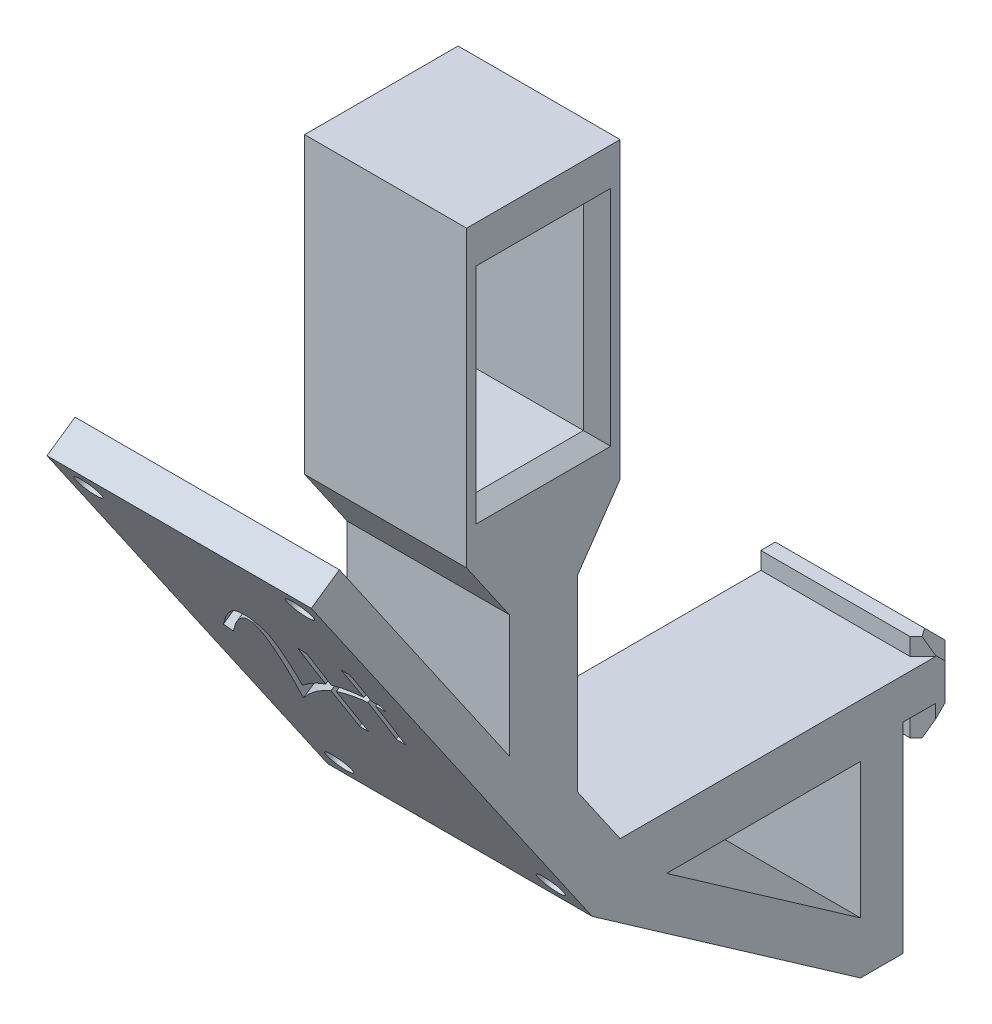
from build123d import *

# Parameters (mm, degrees)
BOSS_EXTRUDE1_DEPTH     = 19
SKETCH3_W               = 5.025645198
SKETCH3_H               = 33.799871634
BOSS_EXTRUDE2_DEPTH     = 19
SKETCH4_W               = 5.025645198
SKETCH4_H               = 7.749871634
CUT_EXTRUDE1_DEPTH      = 41.8379487
SKETCH5_W               = 11.025645198
SKETCH5_H               = 26.05
CUT_EXTRUDE3_DEPTH      = 37.732721166
SKETCH6_W               = 40.5
SKETCH6_H               = 6.25
BOSS_EXTRUDE3_DEPTH     = 19
SKETCH7_W               = 18
SKETCH7_H               = 64
BOSS_EXTRUDE4_DEPTH     = 19
BOSS_EXTRUDE5_DEPTH     = 19
SKETCH10_W              = 12.6
SKETCH10_H              = 23
CUT_EXTRUDE4_DEPTH      = 16
BOSS_EXTRUDE7_DEPTH     = 19
CUT_EXTRUDE6_DEPTH      = 106.993941454
CUT_EXTRUDE7_DEPTH      = 106.993941454
SKETCH20_W              = 9.1
SKETCH20_H              = 10.3
CUT_EXTRUDE10_DEPTH     = 106.993941454
SKETCH21_W              = 5
SKETCH21_H              = 22
BOSS_EXTRUDE8_DEPTH     = 19
SKETCH23_W              = 19
SKETCH23_H              = 18
BOSS_EXTRUDE9_DEPTH     = 2
CHAMFER1_SIZE           = 1.5
SKETCH24_W              = 9
SKETCH24_H              = 4
CUT_EXTRUDE12_DEPTH     = 108.151367817
CUT_EXTRUDE13_DEPTH     = 108.640213791
BOSS_EXTRUDE10_DEPTH    = 19
SKETCH29_W              = 19
SKETCH29_H              = 18
BOSS_EXTRUDE11_DEPTH    = 10
SKETCH30_W              = 12.6
SKETCH30_H              = 23
BOSS_EXTRUDE12_DEPTH    = 19
SKETCH34_W              = 18
SKETCH34_H              = 5
CUT_EXTRUDE16_DEPTH     = 117.038423055
SKETCH36_W              = 31
SKETCH36_H              = 58
BOSS_EXTRUDE13_DEPTH    = 4
SKETCH37_R              = 1.5
CUT_EXTRUDE17_DEPTH     = 5
CUT_EXTRUDE_THIN1_START = -2
CUT_EXTRUDE_THIN1_DEPTH = 2
SKETCH40_W              = 12.6
SKETCH40_H              = 23
CUT_EXTRUDE18_DEPTH     = 16
SKETCH41_W              = 9
SKETCH41_H              = 4
CUT_EXTRUDE19_DEPTH     = 16
CHAMFER2_SIZE           = 1.6


# Read off the part's stored shape, not the designer's step: Cut-Extrude-Thin1
with BuildPart() as part:
    # Sketch2 → Boss-Extrude1 (new body)
    with BuildSketch(Plane(origin=(0, 0, 0), x_dir=(0, 0, -1), z_dir=(1, 0, 0))):
        Polygon((-4.1, 3.125), (-14.1, 3.125), (-14.1, -3.125), (-4.1, -3.125), (-4.1, -5.15), (-2.4, -5.15), (0, -2.75), (0, 2.75), (-2.4, 5.15), (-4.1, 5.15), align=None)
    boss_extrude1 = extrude(amount=BOSS_EXTRUDE1_DEPTH)

    # Sketch3 → Boss-Extrude2 (add)
    with BuildSketch(Plane.ZY):
        with Locations((16.612822599, 13.774935817)):
            Rectangle(SKETCH3_W, SKETCH3_H)
    extrude(amount=-BOSS_EXTRUDE2_DEPTH)

    # Mirror2: Boss-Extrude1 across plane
    add(boss_extrude1.mirror(Plane.ZX.offset(9.9)))

    # Sketch4 → Cut-Extrude1 (cut, through all)
    with BuildSketch(Plane.ZY):
        with Locations((16.612822599, 26.799935817)):
            Rectangle(SKETCH4_W, SKETCH4_H)
    extrude(amount=-CUT_EXTRUDE1_DEPTH, mode=Mode.SUBTRACT)

    # Sketch5 → Cut-Extrude3 (cut, through all)
    with BuildSketch(Plane(origin=(19, 0, 0), x_dir=(0, 0, -1), z_dir=(1, 0, 0))):
        with Locations((-13.612822599, 9.9)):
            Rectangle(SKETCH5_W, SKETCH5_H)
    extrude(amount=-CUT_EXTRUDE3_DEPTH, mode=Mode.SUBTRACT)


with BuildPart() as cut_extrude3_piece_1:
    # of the separate pieces the step leaves, piece 1, a body of its own (cut_extrude3_pieces)
    add(part.part.solids().sort_by_distance((0, 16.675, 8.1))[0])



with BuildPart() as cut_extrude3_piece_2:
    # of the separate pieces the step leaves, piece 2, a body of its own (cut_extrude3_pieces)
    add(part.part.solids().sort_by_distance((0, 3.125, 4.1))[0])


with BuildPart() as cut_extrude3_piece_1_1:
    add(cut_extrude3_piece_1.part)

    add(cut_extrude3_piece_2.part)  # Boss-Extrude3 merges Cut-Extrude3 piece 2
    # Sketch6 → Boss-Extrude3 (add)
    with BuildSketch(Plane(origin=(19, 0, 0), x_dir=(0, 0, -1), z_dir=(1, 0, 0))):
        Polygon((-35.815909091, 16.675), (-48.6, 16.675), (-8.1, -3.125), (-8.1, 3.125), align=None)
        with Locations((-28.35, 19.8)):
            Rectangle(SKETCH6_W, SKETCH6_H)
    extrude(amount=-BOSS_EXTRUDE3_DEPTH)

    # Sketch7 → Boss-Extrude4 (add)
    with BuildSketch(Plane.ZY):
        with Locations((48.6, 54.925)):
            Rectangle(SKETCH7_W, SKETCH7_H)
    extrude(amount=-BOSS_EXTRUDE4_DEPTH)

    # Sketch9 → Boss-Extrude5 (add)
    with BuildSketch(Plane.ZY):
        Polygon((57.6, 22.925), (48.6, 22.925), (48.6, 16.675), align=None)
    extrude(amount=-BOSS_EXTRUDE5_DEPTH)

    # Sketch10 → Cut-Extrude4 (cut)
    with BuildSketch(Plane.ZY):
        with Locations((48.6, 74.425)):
            Rectangle(SKETCH10_W, SKETCH10_H)
    extrude(amount=-CUT_EXTRUDE4_DEPTH, mode=Mode.SUBTRACT)

    # Sketch13 → Boss-Extrude7 (add)
    with BuildSketch(Plane.ZY):
        Polygon((9.1, 16.675), (9.1, 3.613888889), (35.815909091, 16.675), align=None)
    extrude(amount=-BOSS_EXTRUDE7_DEPTH)

    # Sketch14 → Cut-Extrude6 (cut, through all)
    with BuildSketch(Plane.ZY):
        Polygon((39.6, 59.425), (44.6, 52.175), (44.6, 30.175), (39.6, 22.925), align=None)
        Polygon((52.6, 30.175), (57.6, 22.925), (57.6, 59.425), (52.6, 52.175), align=None)
    extrude(amount=-CUT_EXTRUDE6_DEPTH, mode=Mode.SUBTRACT)

    # Sketch16 → Cut-Extrude7 (cut, through all)
    with BuildSketch(Plane(origin=(19, 0, 0), x_dir=(0, 0, -1), z_dir=(1, 0, 0))):
        Polygon((-8.1, -3.125), (-58.554154728, 21.541475645), (-57.6, 22.925), align=None)
    extrude(amount=-CUT_EXTRUDE7_DEPTH, mode=Mode.SUBTRACT)

    # Sketch20 → Cut-Extrude10 (cut, through all)
    with BuildSketch(Plane.ZY):
        Polygon((52.6, 16.675), (9.1, 16.675), (9.1, 5.15), (9.1, -5.15), (52.6, -5.15), align=None)
        with Locations((4.55, 0)):
            Rectangle(SKETCH20_W, SKETCH20_H)
    extrude(amount=-CUT_EXTRUDE10_DEPTH, mode=Mode.SUBTRACT)

    # Sketch21 → Boss-Extrude8 (add, through all)
    with BuildSketch(Plane.ZY):
        with Locations((8.9, 5.675)):
            Rectangle(SKETCH21_W, SKETCH21_H)
    extrude(amount=-BOSS_EXTRUDE8_DEPTH)

    # Sketch23 → Boss-Extrude9 (add)
    with BuildSketch(Plane(origin=(0, 86.925, 0), x_dir=(1, 0, 0), z_dir=(0, 1, 0))):
        with Locations((9.5, -48.6)):
            Rectangle(SKETCH23_W, SKETCH23_H)
    extrude(amount=BOSS_EXTRUDE9_DEPTH)

    # Chamfer1
    # the kernel refuses this chamfer: 1.5 mm, written as the material it takes off along each edge
    with BuildSketch(Plane(origin=(19, 10.792475518, 4.1), x_dir=(0.027495876610586775, 0, -0.9996219169112968), z_dir=(0, 1, 0)), Plane(origin=(19, 22.925, 4.1), x_dir=(0.027495876610586775, 0, -0.9996219169112968), z_dir=(0, 1, 0))) as chamfer1_piece_1:
        Polygon((CHAMFER1_SIZE * 0.999621916911, CHAMFER1_SIZE * 0.0274958766106), (-CHAMFER1_SIZE * 0.0274958766106, CHAMFER1_SIZE * 0.999621916911), (0, 0), align=None)
    extrude(amount=5.882524482, mode=Mode.SUBTRACT)
    with BuildSketch(Plane(origin=(19, 19.77768172, -2.72768172), x_dir=(0.027495876610586747, 0.7068394360706739, 0.7068394360706729), z_dir=(0, -0.707106781186547, 0.707106781186548)), Plane(origin=(19, 27.67768172, 5.12768172), x_dir=(0.027495876610586768, -0.7068394360706726, 0.7068394360706743), z_dir=(0, -0.7071067811865483, -0.7071067811865467))) as chamfer1_piece_2:
        Polygon((CHAMFER1_SIZE * 0.999621916911, CHAMFER1_SIZE * 0.0274958766106), (-CHAMFER1_SIZE * 0.0274958766106, CHAMFER1_SIZE * 0.999621916911), (0, 0), align=None)
    extrude(amount=11.109161514, mode=Mode.SUBTRACT)
    with BuildSketch(Plane(origin=(19, 26.407524482, 0), x_dir=(0.027495876610586778, 1.269416837651831e-15, 0.9996219169112968), z_dir=(0, -1, 0))) as chamfer1_piece_3:
        Polygon((CHAMFER1_SIZE * 0.999621916911, CHAMFER1_SIZE * 0.0274958766106), (-CHAMFER1_SIZE * 0.0274958766106, CHAMFER1_SIZE * 0.999621916911), (0, 0), align=None)
    extrude(amount=13.215048964, mode=Mode.SUBTRACT)
    with BuildSketch(Plane(origin=(19, 16.675, 4.1), x_dir=(0.027495876610586768, 0.9996219169112968, 0), z_dir=(0, 0, 1))) as chamfer1_piece_4:
        Polygon((CHAMFER1_SIZE * 0.999621916911, CHAMFER1_SIZE * 0.0274958766106), (-CHAMFER1_SIZE * 0.0274958766106, CHAMFER1_SIZE * 0.999621916911), (0, 0), align=None)
    extrude(amount=2.3, mode=Mode.SUBTRACT)
    with BuildSketch(Plane(origin=(19, 16.675, 0.242475518), x_dir=(0.027495876610586768, 0.9996219169112968, 0), z_dir=(0, 0, 1))) as chamfer1_piece_5a_section:
        Polygon((CHAMFER1_SIZE * 0.999621916911, CHAMFER1_SIZE * 0.0274958766106), (-CHAMFER1_SIZE * 0.0274958766106, CHAMFER1_SIZE * 0.999621916911), (0, 0), align=None)
    chamfer1_piece_5a = extrude(amount=6.157524482, mode=Mode.PRIVATE)
    chamfer1_piece_5a = split(chamfer1_piece_5a, bisect_by=Plane(origin=(18.50530956, 17.16969044, 4.1), z_dir=(0, 0, -1)), keep=Keep.TOP, mode=Mode.PRIVATE)
    with BuildSketch(Plane(origin=(19, 10.792475518, 4.1), x_dir=(0.027495876610586775, 0, -0.9996219169112968), z_dir=(0, 1, 0))) as chamfer1_piece_5b_section:
        Polygon((CHAMFER1_SIZE * 0.999621916911, CHAMFER1_SIZE * 0.0274958766106), (-CHAMFER1_SIZE * 0.0274958766106, CHAMFER1_SIZE * 0.999621916911), (0, 0), align=None)
    chamfer1_piece_5b = extrude(amount=9.740048964, mode=Mode.PRIVATE)
    chamfer1_piece_5b = split(chamfer1_piece_5b, bisect_by=Plane(origin=(18.50530956, 16.675, 3.60530956), z_dir=(0, 1, 0)), keep=Keep.TOP, mode=Mode.PRIVATE)
    chamfer1_piece_5 = chamfer1_piece_5a & chamfer1_piece_5b
    add(chamfer1_piece_5, mode=Mode.SUBTRACT)

    # Sketch24 → Cut-Extrude12 (cut, through all)
    with BuildSketch(Plane.ZY.offset(-16)):
        with Locations((48.6, 64.925)):
            Rectangle(SKETCH24_W, SKETCH24_H)
    extrude(amount=-CUT_EXTRUDE12_DEPTH, mode=Mode.SUBTRACT)

    # Sketch25 → Cut-Extrude13 (cut, through all)
    with BuildSketch(Plane.ZY):
        Polygon((52.6, 30.766303154), (42.881859894, 16.675), (45.723800384, 16.675), (57.6, 22.925), align=None)
    extrude(amount=-CUT_EXTRUDE13_DEPTH, mode=Mode.SUBTRACT)

    # Sketch28 → Boss-Extrude10 (add, through all)
    with BuildSketch(Plane.ZY):
        Polygon((11.4, -5.325), (42.881859894, 16.675), (34.152967104, 16.675), (11.4, 0.774882346), align=None)
    extrude(amount=-BOSS_EXTRUDE10_DEPTH)

    # Sketch29 → Boss-Extrude11 (add)
    with BuildSketch(Plane(origin=(0, 88.925, 0), x_dir=(1, 0, 0), z_dir=(0, 1, 0))):
        with Locations((9.5, -48.6)):
            Rectangle(SKETCH29_W, SKETCH29_H)
    extrude(amount=BOSS_EXTRUDE11_DEPTH)

    # Sketch30 → Boss-Extrude12 (add, through all)
    with BuildSketch(Plane.ZY):
        with Locations((48.6, 74.425)):
            Rectangle(SKETCH30_W, SKETCH30_H)
    extrude(amount=-BOSS_EXTRUDE12_DEPTH)

    # Sketch34 → Cut-Extrude16 (cut, through all)
    with BuildSketch(Plane.ZY):
        with Locations((48.6, 96.425)):
            Rectangle(SKETCH34_W, SKETCH34_H)
    extrude(amount=-CUT_EXTRUDE16_DEPTH, mode=Mode.SUBTRACT)

    # Sketch36 → Boss-Extrude13 (add)
    with BuildSketch(Plane(origin=(0, -14.666783834, 21.26683656), x_dir=(1, 0, 0), z_dir=(0, -0.5677329558036595, 0.8232127859153066))):
        with Locations((3.5, 67.072518273)):
            Rectangle(SKETCH36_W, SKETCH36_H)
    extrude(amount=-BOSS_EXTRUDE13_DEPTH)

    # Sketch37 → Cut-Extrude17 (cut)
    with BuildSketch(Plane(origin=(0, -14.666783834, 21.26683656), x_dir=(1, 0, 0), z_dir=(0, -0.5677329558036595, 0.8232127859153066))):
        with Locations(Location((-8.9, 92.972518273, 0), (0, 0, 270))):
            Circle(SKETCH37_R)
        with Locations(Location((15.9, 92.972518273, 0), (0, 0, 270))):
            Circle(SKETCH37_R)
        with Locations(Location((15.9, 41.172518273, 0), (0, 0, 270))):
            Circle(SKETCH37_R)
        with Locations(Location((-8.9, 41.172518273, 0), (0, 0, 270))):
            Circle(SKETCH37_R)
    extrude(amount=-CUT_EXTRUDE17_DEPTH, mode=Mode.SUBTRACT)

    # Cut-Extrude-Thin1 outline → Cut-Extrude-Thin1 (cut)
    with BuildSketch(Plane(origin=(0, -14.666783834, 21.26683656), x_dir=(1, 0, 0), z_dir=(0, -0.5677329558036595, 0.8232127859153066)).offset(CUT_EXTRUDE_THIN1_START)):
        with BuildLine():
            add(Edge.make_bspline(
                [(12.819722606, 71.891721205), (12.467350987, 69.027146263), (12.016257218, 66.18097235), (11.466444984, 63.353366575)],
                knots=[0.428290114, 0.428290114, 0.428290114, 0.428290114, 1, 1, 1, 1], degree=3))
            add(Edge.make_bspline(
                [(12.819722606, 71.891721205), (13.460807572, 72.01637124), (14.083838289, 72.050984058)],
                knots=[0.915367491, 0.915367491, 0.915367491, 1, 1, 1], degree=2))
            Line((14.083838289, 72.050984058), (14.028368269, 73.049444411))
            add(Edge.make_bspline(
                [(12.942983362, 72.929627931), (13.306922211, 72.989375516), (13.668784523, 73.029467536), (14.028368269, 73.049444411)],
                knots=[0.920420451, 0.920420451, 0.920420451, 0.920420451, 1, 1, 1, 1], degree=3))
            add(Edge.make_bspline(
                [(13.445435614, 78.360524964), (13.316943497, 76.542993923), (13.149459109, 74.732681085), (12.942983362, 72.929627931)],
                knots=[0, 0, 0, 0, 0.359295345, 0.359295345, 0.359295345, 0.359295345], degree=3))
            Line((13.445435614, 78.360524964), (12.447925246, 78.431044926))
            add(Edge.make_bspline(
                [(12.447925246, 78.431044926), (12.244802092, 75.557852039), (11.910758079, 72.709266295)],
                knots=[0, 0, 0, 0.38167443, 0.38167443, 0.38167443], degree=2))
            add(Edge.make_bspline(
                [(6.595184696, 70.112410703), (6.735581828, 70.2103088), (6.875653575, 70.305848913), (8.224138751, 71.204963789), (9.409914051, 71.834320858), (11.02491464, 72.450195671), (11.469196886, 72.593594477), (11.910758079, 72.709266295)],
                knots=[0.471095163, 0.471095163, 0.471095163, 0.471095163, 0.5, 0.5, 0.75, 0.75, 0.845573754, 0.845573754, 0.845573754, 0.845573754], degree=3))
            add(Edge.make_bspline(
                [(7.640101966, 76.981602559), (7.268933108, 74.717474641), (6.920624171, 72.427743664), (6.595184696, 70.112410703)],
                knots=[0, 0, 0, 0, 0.415393042, 0.415393042, 0.415393042, 0.415393042], degree=3))
            Line((7.640101966, 76.981602559), (6.653274325, 77.143377733))
            add(Edge.make_bspline(
                [(6.653274325, 77.143377733), (6.017113414, 73.262799802), (5.470323811, 69.283113976)],
                knots=[0, 0, 0, 0.473039412, 0.473039412, 0.473039412], degree=2))
            add(Edge.make_bspline(
                [(-0.55681592, 63.449443524), (1.526985957, 65.831573697), (3.530543581, 67.776669297), (5.470323811, 69.283113976)],
                knots=[0, 0, 0, 0, 0.394380239, 0.394380239, 0.394380239, 0.394380239], degree=3))
            add(Edge.make_bspline(
                [(-6.300362652, 69.65911012), (-5.344610287, 71.20203735), (-4.485476111, 72.527612488), (-2.954275062, 74.750823328), (-2.283718611, 75.647577027), (-1.397510328, 76.688851989), (-1.122134049, 76.985487588), (-0.593101493, 77.486785412), (-0.342250447, 77.692545245), (0.069685616, 77.93818792), (0.213854003, 78.009961095), (0.539343655, 78.11985521), (0.723306406, 78.158644487), (1.032580959, 78.153116796), (1.140675524, 78.140089735), (1.356374269, 78.086021348), (1.463635616, 78.044813802), (1.662514421, 77.938006005), (1.753827868, 77.872701283), (1.912993747, 77.729780548), (1.980991621, 77.652434008), (2.153497129, 77.416663082), (2.227674469, 77.256288431), (2.33565774, 76.942663079), (2.369611431, 76.787611964), (2.440268317, 76.312070013), (2.446396742, 75.978580644), (2.409943474, 75.227364349), (2.365428576, 74.810920821), (2.227966042, 73.879618653), (2.134797262, 73.365159897), (1.782700397, 71.665990726), (1.451087095, 70.325221126), (0.593298433, 67.21168847), (0.067082369, 65.439473727), (-0.55681592, 63.449443524)],
                knots=[0, 0, 0, 0, 0.125, 0.125, 0.25, 0.25, 0.3125, 0.3125, 0.375, 0.375, 0.40625, 0.40625, 0.4375, 0.4375, 0.453125, 0.453125, 0.46875, 0.46875, 0.484375, 0.484375, 0.5, 0.5, 0.53125, 0.53125, 0.5625, 0.5625, 0.625, 0.625, 0.6875, 0.6875, 0.75, 0.75, 0.875, 0.875, 1, 1, 1, 1], degree=3))
            Line((-6.300362652, 69.65911012), (-5.450247201, 69.132513766))
            add(Edge.make_bspline(
                [(-5.450247201, 69.132513766), (7.064304277, 89.335489944), (-3.159968941, 58.662670291)],
                knots=[0, 0, 0, 1, 1, 1], degree=2))
            add(Edge.make_bspline(
                [(-3.159968941, 58.662670291), (1.316464976, 64.542039241), (5.275695334, 67.842094682)],
                knots=[0, 0, 0, 0.452979179, 0.452979179, 0.452979179], degree=2))
            add(Edge.make_bspline(
                [(5.275695334, 67.842094682), (4.780418289, 64.110952406), (4.362996065, 60.29347339)],
                knots=[0.558489513, 0.558489513, 0.558489513, 1, 1, 1], degree=2))
            Line((4.362996065, 60.29347339), (5.35707098, 60.184776273))
            add(Edge.make_bspline(
                [(6.405235456, 68.739030913), (6.022352037, 65.925099747), (5.672958242, 63.0736809), (5.35707098, 60.184776273)],
                knots=[0.497346777, 0.497346777, 0.497346777, 0.497346777, 1, 1, 1, 1], degree=3))
            add(Edge.make_bspline(
                [(6.405235456, 68.739030913), (9.229211771, 70.867966423), (11.779877238, 71.633890502)],
                knots=[0.518208561, 0.518208561, 0.518208561, 0.847496575, 0.847496575, 0.847496575], degree=2))
            add(Edge.make_bspline(
                [(11.779877238, 71.633890502), (11.266423928, 67.563864235), (10.484829594, 63.544236234)],
                knots=[0.453776633, 0.453776633, 0.453776633, 1, 1, 1], degree=2))
            Line((10.484829594, 63.544236234), (11.466444984, 63.353366575))
        make_face()
    extrude(amount=CUT_EXTRUDE_THIN1_DEPTH, mode=Mode.SUBTRACT)

    # Sketch40 → Cut-Extrude18 (cut)
    with BuildSketch(Plane(origin=(19, 0, 0), x_dir=(0, 0, -1), z_dir=(1, 0, 0))):
        with Locations((-48.6, 76.425)):
            Rectangle(SKETCH40_W, SKETCH40_H)
    extrude(amount=-CUT_EXTRUDE18_DEPTH, mode=Mode.SUBTRACT)

    # Sketch41 → Cut-Extrude19 (cut)
    with BuildSketch(Plane(origin=(3, 0, 0), x_dir=(0, 0, -1), z_dir=(1, 0, 0))):
        with Locations((-48.6, 66.925)):
            Rectangle(SKETCH41_W, SKETCH41_H)
    extrude(amount=-CUT_EXTRUDE19_DEPTH, mode=Mode.SUBTRACT)

    # Chamfer2
    chamfer2_edges = [cut_extrude3_piece_1_1.edges().sort_by_distance(p)[0] for p in [
        (19, 76.425, 54.9),
        (19, 64.925, 48.6),
        (19, 76.425, 42.3),
        (19, 87.925, 48.6),
    ]]
    chamfer(chamfer2_edges, length=CHAMFER2_SIZE)


solid = cut_extrude3_piece_1_1.part
